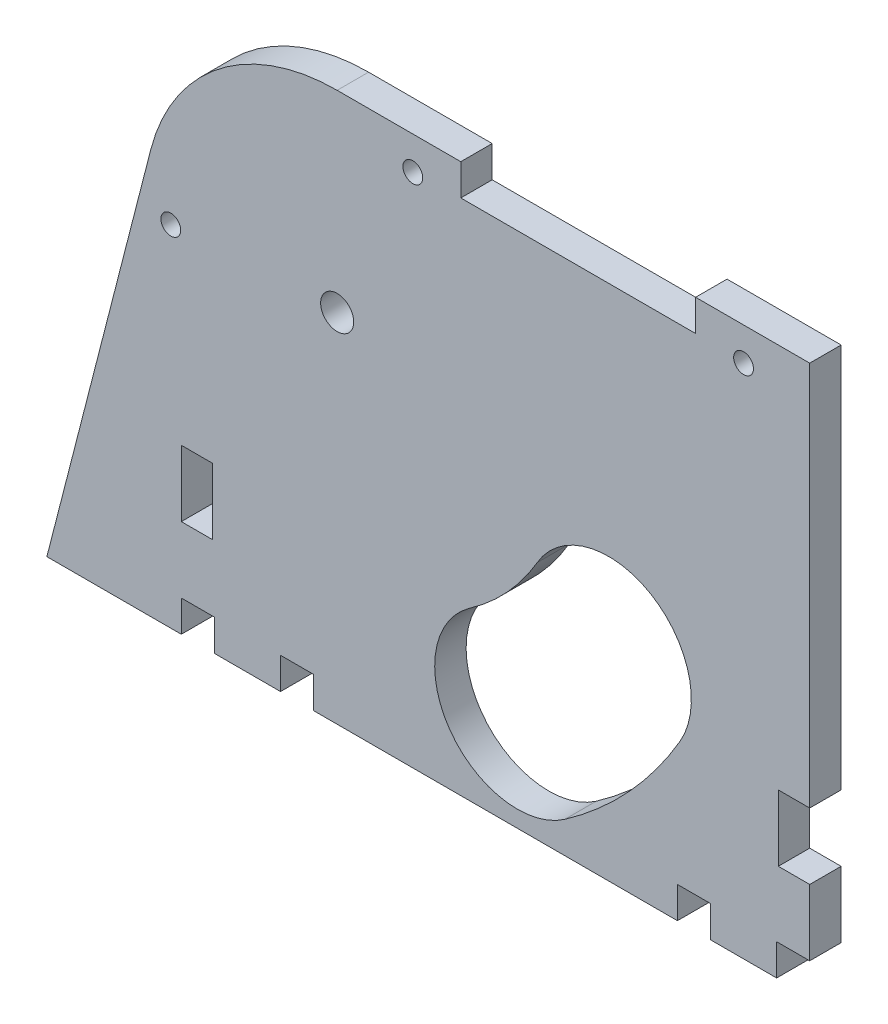
from build123d import *

# Parameters (mm, degrees)
SKETCH1_R           = 2.5
BOSS_EXTRUDE1_DEPTH = 4.75
SKETCH2_W           = 5
SKETCH2_H           = 4.75
SKETCH2_W_2         = 4.75
SKETCH2_H_2         = 10
CUT_EXTRUDE1_DEPTH  = 134.927452376
SKETCH3_R           = 1.5
CUT_EXTRUDE2_DEPTH  = 134.927452376
SKETCH4_W           = 35.5
SKETCH4_H           = 4.75
CUT_EXTRUDE3_DEPTH  = 10
CAVITY1_OUTLINE_R   = 1.5
CAVITY1_DEPTH       = 4.75


# Read off the part's stored shape, not the designer's step: Cavity1
with BuildPart() as part:
    # Sketch1 → Boss-Extrude1 (new body)
    with BuildSketch(Plane.XY):
        with BuildLine():
            Line((-9.685424338, 2.488484559), (5.386220056, 61.148792841))
            ThreePointArc((5.386220056, 61.148792841), (15.733633721, 76.897010412), (33.561388608, 83))
            Line((33.561388608, 83), (105, 83))
            Line((105, 83), (105, 0))
            Line((105, 0), (-10.324792855, 0))
            Line((-10.324792855, 0), (-9.685424338, 2.488484559))
        make_face()
        with Locations((33.561388608, 53.909722104)):
            Circle(SKETCH1_R, mode=Mode.SUBTRACT)
        with BuildLine():
            ThreePointArc((67.975974789, 4.760599446), (77.719162031, 13.288409394), (85.405906554, 23.707967867))
            ThreePointArc((85.405906554, 23.707967867), (80.896997447, 40.800941239), (63.804024076, 36.292032133))
            ThreePointArc((63.804024076, 36.292032133), (59.320089771, 30.213956356), (53.63656388, 25.239400554))
            ThreePointArc((53.63656388, 25.239400554), (50.566868781, 7.830294546), (67.975974789, 4.760599446))
        make_face(mode=Mode.SUBTRACT)
    extrude(amount=BOSS_EXTRUDE1_DEPTH)

    # Sketch2 → Cut-Extrude1 (cut, through all)
    with BuildSketch(Plane.XY.offset(4.75)):
        with Locations((12.5, 2.375)):
            Rectangle(SKETCH2_W, SKETCH2_H)
        with Locations((102.5, 2.375)):
            Rectangle(SKETCH2_W, SKETCH2_H)
        with Locations((27.5, 2.375)):
            Rectangle(SKETCH2_W, SKETCH2_H)
        with Locations((87.5, 2.375)):
            Rectangle(SKETCH2_W, SKETCH2_H)
        with Locations((102.625, 19.75)):
            Rectangle(SKETCH2_W_2, SKETCH2_H_2)
        with Locations((12.375, 19.75)):
            Rectangle(SKETCH2_W_2, SKETCH2_H_2)
    extrude(amount=-CUT_EXTRUDE1_DEPTH, mode=Mode.SUBTRACT)

    # Sketch3 → Cut-Extrude2 (cut, through all)
    with BuildSketch(Plane.XY.offset(4.75)):
        with Locations((95, 78)):
            Circle(SKETCH3_R)
        with Locations((45, 78)):
            Circle(SKETCH3_R)
    extrude(amount=-CUT_EXTRUDE2_DEPTH, mode=Mode.SUBTRACT)

    # Sketch4 → Cut-Extrude3 (cut)
    with BuildSketch(Plane.XY.offset(4.75)):
        with Locations((70, 80.625)):
            Rectangle(SKETCH4_W, SKETCH4_H)
    extrude(amount=-CUT_EXTRUDE3_DEPTH, mode=Mode.SUBTRACT)

    # Cavity1 outline → Cavity1 (cut)
    with BuildSketch(Plane.XY):
        with Locations((8.414860226, 52.844005613)):
            Circle(CAVITY1_OUTLINE_R)
    extrude(amount=CAVITY1_DEPTH, mode=Mode.SUBTRACT)


solid = part.part
